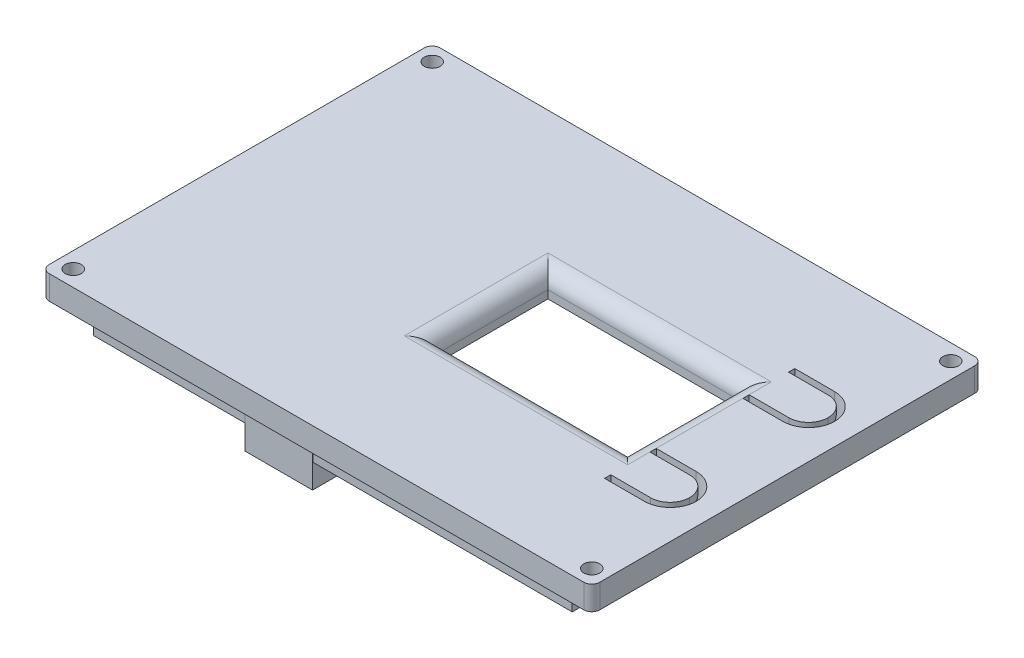
from build123d import *

# Parameters (mm, degrees)
SCHIZZO1_W                        = 69
SCHIZZO1_H                        = 49
ESTRUSIONE_ESTRUSIONE1_DEPTH      = 3
RACCORDO1_R                       = 1
RACCORDO2_R                       = 1
RACCORDO3_R                       = 1
RACCORDO4_R                       = 1
SCHIZZO2_W                        = 60
SCHIZZO2_H                        = 2.231214474
ESTRUSIONE_ESTRUSIONE2_DEPTH      = 3
RACCORDO5_R                       = 3
RACCORDO6_R                       = 3
SCHIZZO3_R                        = 1
TAGLIO_ESTRUSIONE1_DEPTH          = 3
SCHIZZO4_W                        = 24
SCHIZZO4_H                        = 14
TAGLIO_ESTRUSIONE2_DEPTH          = 3
SCHIZZO5_W                        = 23
SCHIZZO5_H                        = 23
TAGLIO_ESTRUSIONE3_DEPTH          = 1.2
RACCORDO7_R                       = 0.5
RACCORDO8_R                       = 0.5
RACCORDO9_R                       = 0.5
RACCORDO10_R                      = 0.5
RACCORDO11_R                      = 2
RACCORDO12_R                      = 2
RACCORDO13_R                      = 2
RACCORDO14_R                      = 2
SCHIZZO6_W                        = 8.444052449
SCHIZZO6_H                        = 8.25
ESTRUSIONE_ESTRUSIONE3_DEPTH      = 6
SCHIZZO7_R                        = 0.9
TAGLIO_ESTRUSIONE4_DEPTH          = 6
ESTRUSIONE_ESTRUSIONE4_DEPTH      = 1.2
ESTRUSIONE_ESTRUSIONE4_DEPTH_BACK = 3
SCHIZZO8_R                        = 1.75
TAGLIO_ESTRUSIONE5_DEPTH          = 3
TAGLIO_ESTRUSIONE6_DEPTH          = 2
SCHIZZO13_R                       = 1.9
ESTRUSIONE_ESTRUSIONE5_DEPTH      = 3.2
SCHIZZO14_R                       = 1.9
ESTRUSIONE_ESTRUSIONE6_DEPTH      = 3.2


with BuildPart() as part:
    # Schizzo1 → Estrusione-Estrusione1 (new body)
    with BuildSketch(Plane(origin=(0, 0, 0), x_dir=(1, 0, 0), z_dir=(0, 1, 0))):
        Rectangle(SCHIZZO1_W, SCHIZZO1_H)
    extrude(amount=ESTRUSIONE_ESTRUSIONE1_DEPTH)

    # Raccordo1
    raccordo1_edges = [part.edges().sort_by_distance(p)[0] for p in [
        (-34.5, 1.5, 24.5),
    ]]
    fillet(raccordo1_edges, radius=RACCORDO1_R)

    # Raccordo2
    raccordo2_edges = [part.edges().sort_by_distance(p)[0] for p in [
        (-34.5, 1.5, -24.5),
    ]]
    fillet(raccordo2_edges, radius=RACCORDO2_R)

    # Raccordo3
    raccordo3_edges = [part.edges().sort_by_distance(p)[0] for p in [
        (34.5, 1.5, 24.5),
    ]]
    fillet(raccordo3_edges, radius=RACCORDO3_R)

    # Raccordo4
    raccordo4_edges = [part.edges().sort_by_distance(p)[0] for p in [
        (34.5, 1.5, -24.5),
    ]]
    fillet(raccordo4_edges, radius=RACCORDO4_R)

    # Schizzo2 → Estrusione-Estrusione2 (add)
    with BuildSketch(Plane.XZ):
        with Locations((0, 21.334392763)):
            Rectangle(SCHIZZO2_W, SCHIZZO2_H)
        with Locations((0, -21.334392763)):
            Rectangle(SCHIZZO2_W, SCHIZZO2_H)
    extrude(amount=ESTRUSIONE_ESTRUSIONE2_DEPTH)

    # Raccordo5
    raccordo5_edges = [part.edges().sort_by_distance(p)[0] for p in [
        (0, 0, 20.218785526),
    ]]
    fillet(raccordo5_edges, radius=RACCORDO5_R - 0.0001)  # a hair under: the kernel refuses the full size

    # Raccordo6
    raccordo6_edges = [part.edges().sort_by_distance(p)[0] for p in [
        (0, 0, -20.218785526),
    ]]
    fillet(raccordo6_edges, radius=RACCORDO6_R - 0.0001)  # a hair under: the kernel refuses the full size

    # Schizzo3 → Taglio-Estrusione1 (cut)
    with BuildSketch(Plane(origin=(0, 3, 0), x_dir=(1, 0, 0), z_dir=(0, 1, 0))):
        with Locations(Location((-32.5, 22.5, 0), (0, 0, 270))):
            Circle(SCHIZZO3_R)
        with Locations(Location((32.5, 22.5, 0), (0, 0, 270))):
            Circle(SCHIZZO3_R)
        with Locations(Location((32.5, -22.5, 0), (0, 0, 270))):
            Circle(SCHIZZO3_R)
        with Locations(Location((-32.5, -22.5, 0), (0, 0, 270))):
            Circle(SCHIZZO3_R)
    extrude(amount=-TAGLIO_ESTRUSIONE1_DEPTH, mode=Mode.SUBTRACT)

    # Schizzo4 → Taglio-Estrusione2 (cut)
    with BuildSketch(Plane.XZ):
        with Locations((9.5, 0)):
            Rectangle(SCHIZZO4_W, SCHIZZO4_H)
    extrude(amount=-TAGLIO_ESTRUSIONE2_DEPTH, mode=Mode.SUBTRACT)

    # Schizzo5 → Taglio-Estrusione3 (cut)
    with BuildSketch(Plane.XZ):
        with Locations((-21.5, 0)):
            Rectangle(SCHIZZO5_W, SCHIZZO5_H)
    extrude(amount=-TAGLIO_ESTRUSIONE3_DEPTH, mode=Mode.SUBTRACT)

    # Raccordo7
    raccordo7_edges = [part.edges().sort_by_distance(p)[0] for p in [
        (-33, 0.6, 11.5),
    ]]
    fillet(raccordo7_edges, radius=RACCORDO7_R)

    # Raccordo8
    raccordo8_edges = [part.edges().sort_by_distance(p)[0] for p in [
        (-10, 0.6, 11.5),
    ]]
    fillet(raccordo8_edges, radius=RACCORDO8_R)

    # Raccordo9
    raccordo9_edges = [part.edges().sort_by_distance(p)[0] for p in [
        (-33, 0.6, -11.5),
    ]]
    fillet(raccordo9_edges, radius=RACCORDO9_R)

    # Raccordo10
    raccordo10_edges = [part.edges().sort_by_distance(p)[0] for p in [
        (-10, 0.6, -11.5),
    ]]
    fillet(raccordo10_edges, radius=RACCORDO10_R)

    # Raccordo11
    raccordo11_edges = [part.edges().sort_by_distance(p)[0] for p in [
        (21.5, 3, 0),
    ]]
    fillet(raccordo11_edges, radius=RACCORDO11_R)

    # Raccordo12
    raccordo12_edges = [part.edges().sort_by_distance(p)[0] for p in [
        (10.5, 3, 7),
    ]]
    fillet(raccordo12_edges, radius=RACCORDO12_R)

    # Raccordo13
    raccordo13_edges = [part.edges().sort_by_distance(p)[0] for p in [
        (-2.5, 3, 1),
    ]]
    fillet(raccordo13_edges, radius=RACCORDO13_R)

    # Raccordo14
    raccordo14_edges = [part.edges().sort_by_distance(p)[0] for p in [
        (9.5, 3, -7),
    ]]
    fillet(raccordo14_edges, radius=RACCORDO14_R)

    # Schizzo6 → Estrusione-Estrusione3 (add)
    with BuildSketch(Plane.XZ):
        with Locations((-6.722026225, 18.375)):
            Rectangle(SCHIZZO6_W, SCHIZZO6_H)
        with Locations((-6.722026225, -18.375)):
            Rectangle(SCHIZZO6_W, SCHIZZO6_H)
    extrude(amount=ESTRUSIONE_ESTRUSIONE3_DEPTH)

    # Schizzo7 → Taglio-Estrusione4 (cut)
    with BuildSketch(Plane.XZ.offset(6)):
        with Locations(Location((-6.72, 18.375, 0), (0, 0, 270))):
            Circle(SCHIZZO7_R)
        with Locations(Location((-6.72, -18.375, 0), (0, 0, 90))):
            Circle(SCHIZZO7_R)
    extrude(amount=-TAGLIO_ESTRUSIONE4_DEPTH, mode=Mode.SUBTRACT)

    # Schizzo8 → Estrusione-Estrusione4 (add, two sides: drawn at the far end of the back side and taken through both)
    with BuildSketch(Plane.XZ.offset(-ESTRUSIONE_ESTRUSIONE4_DEPTH_BACK)):
        with Locations(Location((28.5, 8.7, 0), (0, 0, 270))):
            Circle(SCHIZZO8_R)
        with Locations(Location((28.5, -8.7, 0), (0, 0, 90))):
            Circle(SCHIZZO8_R)
    extrude(amount=ESTRUSIONE_ESTRUSIONE4_DEPTH + ESTRUSIONE_ESTRUSIONE4_DEPTH_BACK)

    # Schizzo9 → Taglio-Estrusione5 (cut)
    with BuildSketch(Plane.XZ):
        with BuildLine():
            Line((28.523054823, 11.139507375), (23.522221501, 11.139507375))
            Line((23.522221501, 11.139507375), (23.522221501, 11.920576973))
            Line((23.522221501, 11.920576973), (28.476945177, 11.920576973))
            ThreePointArc((28.476945177, 11.920576973), (30.793594038, 10.980088836), (31.766686618, 8.676945177))
            ThreePointArc((31.766686618, 8.676945177), (30.793594038, 6.373801519), (28.476945177, 5.433313382))
            Line((28.476945177, 5.433313382), (23.522221501, 5.433313382))
            Line((23.522221501, 5.433313382), (23.522221501, 6.21438298))
            Line((23.522221501, 6.21438298), (28.523054823, 6.21438298))
            ThreePointArc((28.523054823, 6.21438298), (30.241294429, 6.945200369), (30.939507375, 8.676945177))
            ThreePointArc((30.939507375, 8.676945177), (30.241294429, 10.408689986), (28.523054823, 11.139507375))
        make_face()
        with BuildLine():
            Line((23.522221501, -5.433313382), (23.522221501, -6.21438298))
            Line((23.522221501, -6.21438298), (28.523054823, -6.21438298))
            ThreePointArc((28.523054823, -6.21438298), (30.241294429, -6.945200369), (30.939507375, -8.676945177))
            ThreePointArc((30.939507375, -8.676945177), (30.241294429, -10.408689986), (28.523054823, -11.139507375))
            Line((28.523054823, -11.139507375), (23.522221501, -11.139507375))
            Line((23.522221501, -11.139507375), (23.522221501, -11.920576973))
            Line((23.522221501, -11.920576973), (28.476945177, -11.920576973))
            ThreePointArc((28.476945177, -11.920576973), (30.793594038, -10.980088836), (31.766686618, -8.676945177))
            ThreePointArc((31.766686618, -8.676945177), (30.793594038, -6.373801519), (28.476945177, -5.433313382))
            Line((28.476945177, -5.433313382), (23.522221501, -5.433313382))
        make_face()
    extrude(amount=-TAGLIO_ESTRUSIONE5_DEPTH, mode=Mode.SUBTRACT)

    # Schizzo11 → Taglio-Estrusione6 (cut)
    with BuildSketch(Plane.XZ):
        with BuildLine():
            Line((28.523054823, 11.139507375), (23.522221501, 11.139507375))
            Line((23.522221501, 11.139507375), (23.522221501, 6.21438298))
            Line((23.522221501, 6.21438298), (28.523054823, 6.21438298))
            ThreePointArc((28.523054823, 6.21438298), (30.248124061, 6.938498616), (30.939507375, 8.676945177))
            ThreePointArc((30.939507375, 8.676945177), (30.248124061, 10.415391738), (28.523054823, 11.139507375))
        make_face()
        with BuildLine():
            Line((23.522221501, -6.21438298), (28.523054823, -6.21438298))
            ThreePointArc((28.523054823, -6.21438298), (30.248124061, -6.938498616), (30.939507375, -8.676945177))
            ThreePointArc((30.939507375, -8.676945177), (30.248124061, -10.415391738), (28.523054823, -11.139507375))
            Line((28.523054823, -11.139507375), (23.522221501, -11.139507375))
            Line((23.522221501, -11.139507375), (23.522221501, -6.21438298))
        make_face()
    extrude(amount=-TAGLIO_ESTRUSIONE6_DEPTH, mode=Mode.SUBTRACT)


with BuildPart() as taglio_estrusione6_piece_1:
    # of the separate pieces the step leaves, piece 1, a body of its own (taglio_estrusione6_pieces)
    add(part.part.solids().sort_by_distance((34.5, 3, -23.5))[0])



with BuildPart() as taglio_estrusione6_piece_2:
    # of the separate pieces the step leaves, piece 2, a body of its own (taglio_estrusione6_pieces)
    add(part.part.solids().sort_by_distance((28.5, 0, 6.95))[0])


with BuildPart() as taglio_estrusione6_piece_3:
    # of the separate pieces the step leaves, piece 3, a body of its own (taglio_estrusione6_pieces)
    add(part.part.solids().sort_by_distance((28.5, 0, -6.95))[0])


with BuildPart() as taglio_estrusione6_piece_1_1:
    add(taglio_estrusione6_piece_1.part)

    add(taglio_estrusione6_piece_2.part)  # Estrusione-Estrusione5 merges Taglio-Estrusione6 piece 2
    # Schizzo13 → Estrusione-Estrusione5 (add)
    with BuildSketch(Plane.XZ.offset(-2)):
        with Locations(Location((28.5, 8.7, 0), (0, 0, 90))):
            Circle(SCHIZZO13_R)
    extrude(amount=ESTRUSIONE_ESTRUSIONE5_DEPTH)


    add(taglio_estrusione6_piece_3.part)  # Estrusione-Estrusione6 merges Taglio-Estrusione6 piece 3
    # Schizzo14 → Estrusione-Estrusione6 (add)
    with BuildSketch(Plane.XZ.offset(-2)):
        with Locations(Location((28.5, -8.7, 0), (0, 0, 90))):
            Circle(SCHIZZO14_R)
    extrude(amount=ESTRUSIONE_ESTRUSIONE6_DEPTH)


solid = taglio_estrusione6_piece_1_1.part
